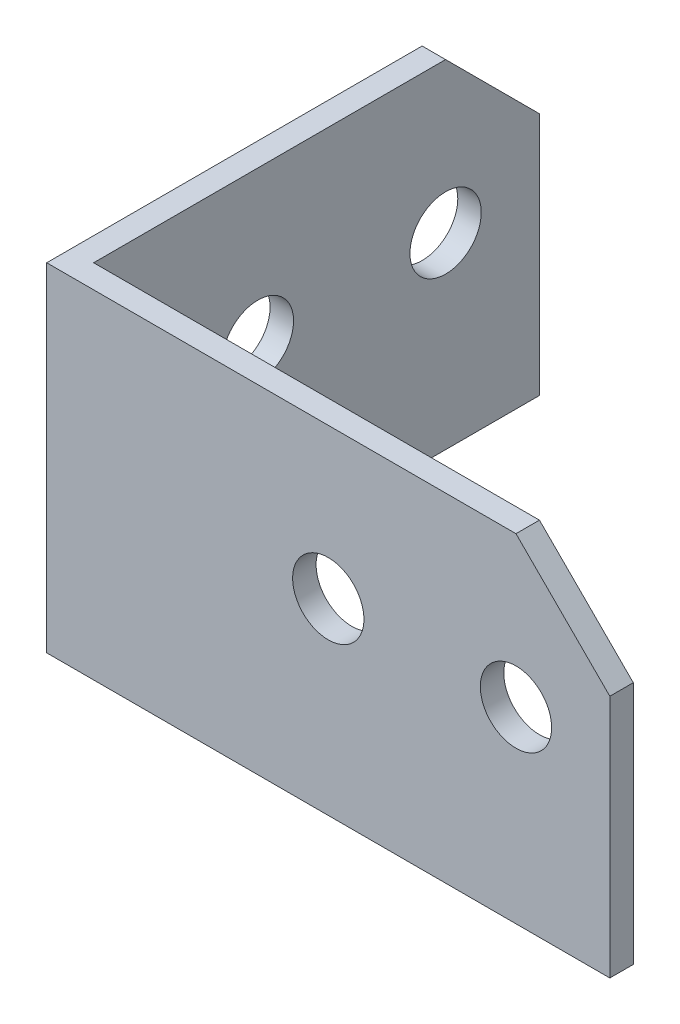
from build123d import *

# Parameters (mm, degrees)
BOSS_EXTRUDE1_DEPTH = 45.72
SKETCH2_R           = 2.413
CUT_EXTRUDE1_DEPTH  = 59.307156693
SKETCH3_R           = 2.413
CUT_EXTRUDE2_DEPTH  = 64.762509842
CHAMFER1_SIZE       = 6.35
CUT_EXTRUDE3_DEPTH  = 59.307156693
CUT_EXTRUDE4_DEPTH  = 64.762509842
SKETCH6_W           = 1.5875
SKETCH6_H           = 22.86
CUT_EXTRUDE5_DEPTH  = 60.143982072


with BuildPart() as part:
    # Sketch1 → Boss-Extrude1 (new body)
    with BuildSketch(Plane(origin=(0, 0, 0), x_dir=(1, 0, 0), z_dir=(0, 1, 0))):
        Polygon((-18.109259259, 25.341203704), (-16.521759259, 25.341203704), (-16.521759259, -4.821296296), (19.990740741, -4.821296296), (19.990740741, -6.408796296), (-18.109259259, -6.408796296), align=None)
    extrude(amount=BOSS_EXTRUDE1_DEPTH)

    # Sketch2 → Cut-Extrude1 (cut, through all)
    with BuildSketch(Plane(origin=(0, 0, 4.821296296), x_dir=(-1, 0, 0), z_dir=(0, 0, -1))):
        with Locations((-0.940740741, 35.56)):
            Circle(SKETCH2_R)
        with Locations((-13.640740741, 35.56)):
            Circle(SKETCH2_R)
        with Locations((-13.640740741, 10.16)):
            Circle(SKETCH2_R)
        with Locations((-0.940740741, 10.16)):
            Circle(SKETCH2_R)
    extrude(amount=-CUT_EXTRUDE1_DEPTH, mode=Mode.SUBTRACT)

    # Sketch3 → Cut-Extrude2 (cut, through all)
    with BuildSketch(Plane(origin=(-16.521759259, 0, 0), x_dir=(0, 0, -1), z_dir=(1, 0, 0))):
        with Locations((6.291203704, 35.56)):
            Circle(SKETCH3_R)
        with Locations((18.991203704, 35.56)):
            Circle(SKETCH3_R)
        with Locations((18.991203704, 10.16)):
            Circle(SKETCH3_R)
        with Locations((6.291203704, 10.16)):
            Circle(SKETCH3_R)
    extrude(amount=-CUT_EXTRUDE2_DEPTH, mode=Mode.SUBTRACT)

    # Chamfer1
    chamfer1_edges = [part.edges().sort_by_distance(p)[0] for p in [
        (19.990740741, 45.72, 5.615046296),
        (19.990740741, 0, 5.615046296),
        (-17.315509259, 0, -25.341203704),
        (-17.315509259, 45.72, -25.341203704),
    ]]
    chamfer(chamfer1_edges, length=CHAMFER1_SIZE)

    # Sketch4 → Cut-Extrude3 (cut, through all)
    with BuildSketch(Plane(origin=(0, 0, 4.821296296), x_dir=(-1, 0, 0), z_dir=(0, 0, -1))):
        Polygon((-19.990740741, 22.86), (16.521759259, 22.86), (16.521759259, 0), (-13.640740741, 0), (-19.990740741, 6.35), align=None)
    extrude(amount=-CUT_EXTRUDE3_DEPTH, mode=Mode.SUBTRACT)

    # Sketch5 → Cut-Extrude4 (cut, through all)
    with BuildSketch(Plane(origin=(-16.521759259, 0, 0), x_dir=(0, 0, -1), z_dir=(1, 0, 0))):
        Polygon((25.341203704, 22.86), (-4.821296296, 22.86), (-4.821296296, 0), (18.991203704, 0), (25.341203704, 6.35), align=None)
    extrude(amount=-CUT_EXTRUDE4_DEPTH, mode=Mode.SUBTRACT)

    # Sketch6 → Cut-Extrude5 (cut, through all)
    with BuildSketch(Plane.XY.offset(6.408796296)):
        with Locations((-17.315509259, 11.43)):
            Rectangle(SKETCH6_W, SKETCH6_H)
    extrude(amount=-CUT_EXTRUDE5_DEPTH, mode=Mode.SUBTRACT)


solid = part.part
